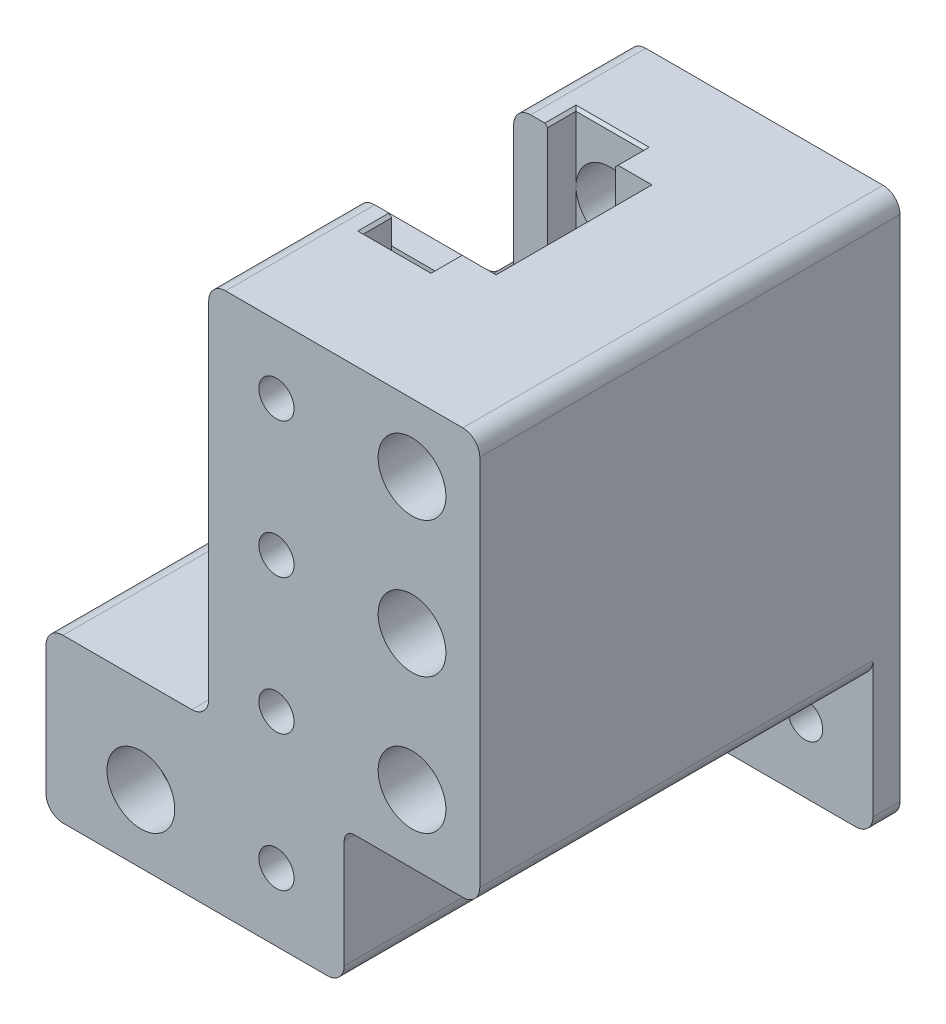
from build123d import *

# Parameters (mm, degrees)
EXTRUDE_1_DEPTH          = 4
EXTRUDE_3_DEPTH          = 58
CUT_EXTRUDE_6_DEPTH      = 11.5
CUT_EXTRUDE_4_DEPTH      = 15.7
CUT_EXTRUDE_3_DEPTH      = 7.5
CUT_EXTRUDE_7_DEPTH      = 130.011627383
CUT_EXTRUDE_7_DEPTH_BACK = 130.011627383
SKETCH_11_R              = 2.6
SKETCH_12_R              = 5
CUT_EXTRUDE_8_DEPTH      = 58
SKETCH_16_R              = 5
CUT_EXTRUDE_11_DEPTH     = 13
SKETCH_13_R              = 5
CUT_EXTRUDE_9_DEPTH      = 7
SKETCH_14_R              = 2.6
CUT_EXTRUDE_10_DEPTH     = 4
CHAMFER_1_SIZE           = 0.4
FILLET_1_R               = 1.5
FILLET_2_R               = 2.5


with BuildPart() as part:
    # Эскиз1 → Бобышка-Вытянуть1 (new body)
    with BuildSketch(Plane.XY):
        Polygon((0, 0), (80, 0), (80, 40), (60, 40), (40, 60), (40, 80), (0, 80), align=None)
    extrude(amount=EXTRUDE_1_DEPTH)

    # Эскиз7 → Бобышка-Вытянуть3 (add)
    with BuildSketch(Plane.XY.offset(4)):
        Polygon((64, 24), (64, 0), (20, 0), (20, 20), (0, 20), (0, 80), (40, 80), (40, 24), align=None)
    extrude(amount=EXTRUDE_3_DEPTH)

    # Эскиз9 → Вырез-Вытянуть6 (cut, symmetric)
    with BuildSketch(Plane.XY.offset(28.5)):
        Polygon((20, 80), (40, 80), (40, 24), (38.8, 24), (38.8, 4), (21.2, 4), (21.2, 24), (20, 24), align=None)
    extrude(amount=CUT_EXTRUDE_6_DEPTH, both=True, mode=Mode.SUBTRACT)

    # Эскиз8 → Вырез-Вытянуть4 (cut, symmetric)
    with BuildSketch(Plane.XY.offset(28.5)):
        with BuildLine():
            Line((25, 10), (25, 80))
            Line((25, 80), (35, 80))
            Line((35, 80), (35, 10))
            ThreePointArc((35, 10), (30, 5), (25, 10))
        make_face()
    extrude(amount=CUT_EXTRUDE_4_DEPTH, both=True, mode=Mode.SUBTRACT)

    # Эскиз6 → Вырез-Вытянуть3 (cut, symmetric)
    with BuildSketch(Plane.XY.offset(42.5)):
        with BuildLine():
            Line((41.6, 24), (45, 24))
            Line((45, 24), (45, 18.660254038))
            ThreePointArc((45, 18.660254038), (55, 18.660254038), (60, 10))
            Line((60, 10), (60, 5.6))
            Line((60, 5.6), (64, 5.6))
            Line((64, 5.6), (64, 0))
            Line((64, 0), (40, 0))
            Line((40, 0), (40, 10))
            ThreePointArc((40, 10), (40.408336953, 12.828427125), (41.6, 15.425863987))
            Line((41.6, 15.425863987), (41.6, 24))
        make_face()
    extrude(amount=CUT_EXTRUDE_3_DEPTH, both=True, mode=Mode.SUBTRACT)

    # Эскиз11 → Вырез-Вытянуть7 (cut, two sides: drawn at the far end of the back side and taken through both)
    with BuildSketch(Plane(origin=(0, 0, 0), x_dir=(-1, 0, 0), z_dir=(0, 0, -1)).offset(-CUT_EXTRUDE_7_DEPTH_BACK)):
        with Locations(Location((-10, 10, 0), (0, 0, 180))):
            Circle(SKETCH_11_R)
        with Locations((-30, 30)):
            Circle(SKETCH_11_R)
        with Locations((-30, 50)):
            Circle(SKETCH_11_R)
        with Locations((-30, 70)):
            Circle(SKETCH_11_R)
        with Locations((-10, 30)):
            Circle(SKETCH_11_R)
        with Locations((-10, 50)):
            Circle(SKETCH_11_R)
        with Locations((-10, 70)):
            Circle(SKETCH_11_R)
        with Locations(Location((-50, 10, 0), (0, 0, 180))):
            Circle(SKETCH_11_R)
        with Locations(Location((-50, 30, 0), (0, 0, 180))):
            Circle(SKETCH_11_R)
        with Locations(Location((-70, 10, 0), (0, 0, 180))):
            Circle(SKETCH_11_R)
        with Locations(Location((-70, 30, 0), (0, 0, 180))):
            Circle(SKETCH_11_R)
        with Locations((-30, 10)):
            Circle(SKETCH_11_R)
    extrude(amount=CUT_EXTRUDE_7_DEPTH + CUT_EXTRUDE_7_DEPTH_BACK, mode=Mode.SUBTRACT)

    # Эскиз12 → Вырез-Вытянуть8 (cut)
    with BuildSketch(Plane.XY.offset(62)):
        with Locations((10, 70)):
            Circle(SKETCH_12_R)
        with Locations((10, 50)):
            Circle(SKETCH_12_R)
        with Locations((10, 30)):
            Circle(SKETCH_12_R)
    extrude(amount=-CUT_EXTRUDE_8_DEPTH, mode=Mode.SUBTRACT)

    # Эскиз16 → Вырез-Вытянуть11 (cut)
    with BuildSketch(Plane.XY.offset(17)):
        with Locations((30, 70)):
            Circle(SKETCH_16_R)
        with Locations((30, 50)):
            Circle(SKETCH_16_R)
        with Locations((30, 30)):
            Circle(SKETCH_16_R)
        with Locations((30, 10)):
            Circle(SKETCH_16_R)
    extrude(amount=-CUT_EXTRUDE_11_DEPTH, mode=Mode.SUBTRACT)

    # Эскиз13 → Вырез-Вытянуть9 (cut)
    with BuildSketch(Plane.XY.offset(62)):
        with Locations((50, 10)):
            Circle(SKETCH_13_R)
    extrude(amount=-CUT_EXTRUDE_9_DEPTH, mode=Mode.SUBTRACT)

    # Эскиз14 → Вырез-Вытянуть10 (cut)
    with BuildSketch(Plane.XZ):
        with Locations(Location((30, 28.5, 0), (0, 0, 270))):
            Circle(SKETCH_14_R)
    extrude(amount=-CUT_EXTRUDE_10_DEPTH, mode=Mode.SUBTRACT)

    # Фаска1
    chamfer_1_edges = [part.edges().sort_by_distance(p)[0] for p in [
        (20, 80, 28.5),
        (21.2, 24, 28.5),
        (38.8, 24, 28.5),
        (25, 80, 42.1),
        (35, 80, 42.1),
        (30, 80, 12.8),
        (25, 80, 14.9),
        (35, 80, 14.9),
        (30, 80, 44.2),
    ]]
    chamfer(chamfer_1_edges, length=CHAMFER_1_SIZE)

    # Скругление1
    fillet_1_edges = [part.edges().sort_by_distance(p)[0] for p in [
        (20, 20, 33),
    ]]
    fillet(fillet_1_edges, radius=FILLET_1_R)

    # Скругление2
    # the kernel refuses this fillet: 2.5 mm, written as the material it adds along each edge
    with BuildSketch(Plane(origin=(40, 60, 0), x_dir=(0, 1, 0), z_dir=(0, 0, 1))) as fillet_2_piece_1:
        with BuildLine():
            CenterArc((FILLET_2_R * 0.414213562373, -FILLET_2_R), FILLET_2_R, 90, 45)
            Line((-FILLET_2_R * 0.292893218813, -FILLET_2_R * 0.292893218813), (0, 0))
            Line((0, 0), (FILLET_2_R * 0.414213562373, 0))
        make_face()
    extrude(amount=4)
    with BuildSketch(Plane(origin=(60, 40, 0), x_dir=(1, 0, 0), z_dir=(0, 0, 1))) as fillet_2_piece_2:
        with BuildLine():
            CenterArc((FILLET_2_R * 0.414213562373, FILLET_2_R), FILLET_2_R, 225, 45)
            Line((-FILLET_2_R * 0.292893218813, FILLET_2_R * 0.292893218813), (0, 0))
            Line((0, 0), (FILLET_2_R * 0.414213562373, 0))
        make_face()
    extrude(amount=4)
    with BuildSketch(Plane(origin=(40, 24, 40), x_dir=(1, 0, 0), z_dir=(0, 0, 1))) as fillet_2_piece_3_section:
        with BuildLine():
            CenterArc((FILLET_2_R, FILLET_2_R), FILLET_2_R, 180, 90)
            Line((0, FILLET_2_R), (0, 0))
            Line((0, 0), (FILLET_2_R, 0))
        make_face()
    fillet_2_piece_3 = extrude(amount=22, mode=Mode.PRIVATE)
    fillet_2_piece_3 = split(fillet_2_piece_3, bisect_by=Plane(origin=(41.6, 24.577940424, 45), z_dir=(-1, 0, 0)), keep=Keep.TOP, mode=Mode.PRIVATE)
    add(fillet_2_piece_3)
    with BuildSketch(Plane(origin=(40, 24, 33.75), x_dir=(1, 0, 0), z_dir=(0, 0, 1))) as fillet_2_piece_4_section:
        with BuildLine():
            CenterArc((FILLET_2_R, FILLET_2_R), FILLET_2_R, 180, 90)
            Line((0, FILLET_2_R), (0, 0))
            Line((0, 0), (FILLET_2_R, 0))
        make_face()
    fillet_2_piece_4 = extrude(amount=28.25, mode=Mode.PRIVATE)
    fillet_2_piece_4 = split(fillet_2_piece_4, bisect_by=Plane(origin=(41.823463769, 24.049982966, 50), z_dir=(0, 0, 1)), keep=Keep.TOP, mode=Mode.PRIVATE)
    add(fillet_2_piece_4)
    with BuildSketch(Plane(origin=(40, 24, 4), x_dir=(1, 0, 0), z_dir=(0, 0, 1))) as fillet_2_piece_5:
        with BuildLine():
            CenterArc((FILLET_2_R, FILLET_2_R), FILLET_2_R, 180, 90)
            Line((0, FILLET_2_R), (0, 0))
            Line((0, 0), (FILLET_2_R, 0))
        make_face()
    extrude(amount=13)
    # the kernel refuses this fillet: 2.5 mm, written as the material it takes off along each edge
    with BuildSketch(Plane(origin=(0, 80, 68.25), x_dir=(1, 0, 0), z_dir=(0, 0, -1))) as fillet_2_2_piece_1:
        with BuildLine():
            CenterArc((FILLET_2_R, FILLET_2_R), FILLET_2_R, 180, 90)
            Line((0, FILLET_2_R), (0, 0))
            Line((0, 0), (FILLET_2_R, 0))
        make_face()
    extrude(amount=74.5, mode=Mode.SUBTRACT)
    with BuildSketch(Plane(origin=(40, 80, 68.25), x_dir=(0, -1, 0), z_dir=(0, 0, -1))) as fillet_2_2_piece_2:
        with BuildLine():
            CenterArc((FILLET_2_R, FILLET_2_R), FILLET_2_R, 180, 90)
            Line((0, FILLET_2_R), (0, 0))
            Line((0, 0), (FILLET_2_R, 0))
        make_face()
    extrude(amount=34.5, mode=Mode.SUBTRACT)
    with BuildSketch(Plane(origin=(80, 40, -6.25), x_dir=(-1, 0, 0), z_dir=(0, 0, 1)), Plane(origin=(80, 0, -6.25), x_dir=(0, 1, 0), z_dir=(0, 0, 1))) as fillet_2_2_piece_3:
        with BuildLine():
            CenterArc((FILLET_2_R, FILLET_2_R), FILLET_2_R, 180, 90)
            Line((0, FILLET_2_R), (0, 0))
            Line((0, 0), (FILLET_2_R, 0))
        make_face()
    extrude(amount=16.5, mode=Mode.SUBTRACT)
    with BuildSketch(Plane(origin=(0, 0, -6.25), x_dir=(0, 1, 0), z_dir=(0, 0, 1))) as fillet_2_2_piece_4:
        with BuildLine():
            CenterArc((FILLET_2_R, -FILLET_2_R), FILLET_2_R, 90, 90)
            Line((0, -FILLET_2_R), (0, 0))
            Line((0, 0), (FILLET_2_R, 0))
        make_face()
    extrude(amount=16.5, mode=Mode.SUBTRACT)
    with BuildSketch(Plane(origin=(20, 0, 4), x_dir=(0, 1, 0), z_dir=(0, 0, 1)), Plane(origin=(64, 24, 4), x_dir=(0, -1, 0), z_dir=(0, 0, 1)), Plane(origin=(0, 20, 4), x_dir=(0, 1, 0), z_dir=(0, 0, 1))) as fillet_2_2_piece_5:
        with BuildLine():
            CenterArc((FILLET_2_R, -FILLET_2_R), FILLET_2_R, 90, 90)
            Line((0, -FILLET_2_R), (0, 0))
            Line((0, 0), (FILLET_2_R, 0))
        make_face()
    extrude(amount=64.25, mode=Mode.SUBTRACT)
    with BuildSketch(Plane(origin=(64, 0, 43.75), x_dir=(0, 1, 0), z_dir=(0, 0, 1))) as fillet_2_2_piece_6:
        with BuildLine():
            CenterArc((FILLET_2_R, FILLET_2_R), FILLET_2_R, 180, 90)
            Line((0, FILLET_2_R), (0, 0))
            Line((0, 0), (FILLET_2_R, 0))
        make_face()
    extrude(amount=24.5, mode=Mode.SUBTRACT)
    with BuildSketch(Plane(origin=(40, 80, 23.25), x_dir=(0, -1, 0), z_dir=(0, 0, -1))) as fillet_2_2_piece_7:
        with BuildLine():
            CenterArc((FILLET_2_R, FILLET_2_R), FILLET_2_R, 180, 90)
            Line((0, FILLET_2_R), (0, 0))
            Line((0, 0), (FILLET_2_R, 0))
        make_face()
    extrude(amount=29.5, mode=Mode.SUBTRACT)
    with BuildSketch(Plane(origin=(64, 0, 4), x_dir=(0, 1, 0), z_dir=(0, 0, 1))) as fillet_2_2_piece_8:
        with BuildLine():
            CenterArc((FILLET_2_R, FILLET_2_R), FILLET_2_R, 180, 90)
            Line((0, FILLET_2_R), (0, 0))
            Line((0, 0), (FILLET_2_R, 0))
        make_face()
    extrude(amount=37.25, mode=Mode.SUBTRACT)


with BuildPart() as body_2:
    # Зеркальное отражение1: mirrored copy
    add(part.part.mirror(Plane(origin=(0, 0, 0), x_dir=(0, 0, 1), z_dir=(1, 0, 0))))


solid = body_2.part
